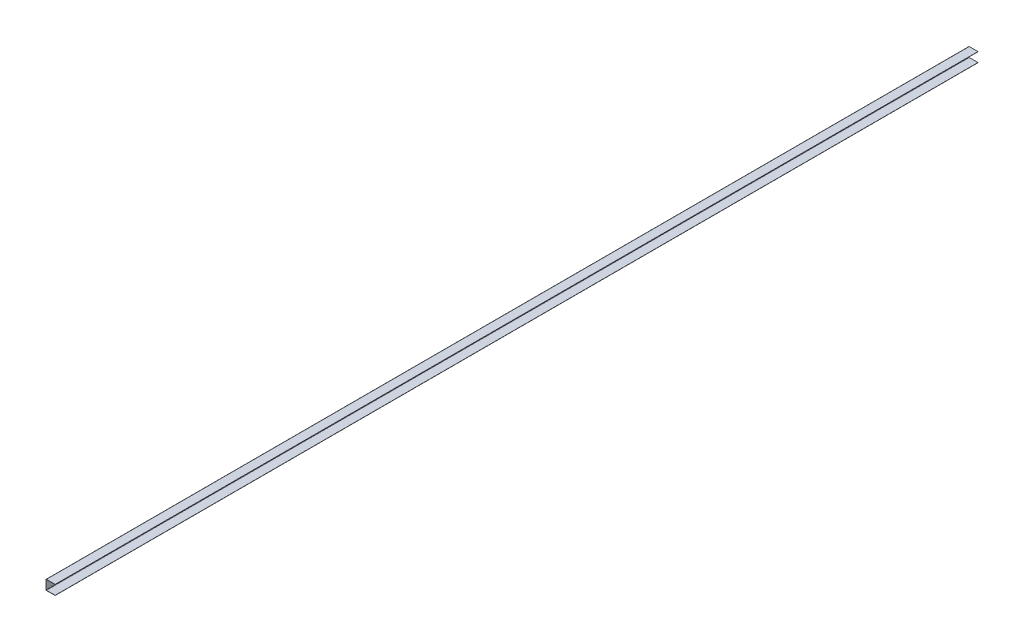
from build123d import *

# Parameters (mm, degrees)
SM_BASE_FLANGE_1_DEPTH = 2775


# Sheet-metal steps are written as plain solids
with BuildPart() as part:
    # Sketch 1 → Базовая кромка1 (new body)
    with BuildSketch(Plane.XY):
        with BuildLine():
            Line((27, 14), (0.75, 14))
            ThreePointArc((0.75, 14), (0.219669914, 13.780330086), (0, 13.25))
            Line((0, 13.25), (0, -13.25))
            ThreePointArc((0, -13.25), (0.219669914, -13.780330086), (0.75, -14))
            Line((0.75, -14), (27, -14))
            Line((27, -14), (27, -14.5))
            Line((27, -14.5), (0.75, -14.5))
            ThreePointArc((0.75, -14.5), (-0.133883476, -14.133883476), (-0.5, -13.25))
            Line((-0.5, -13.25), (-0.5, 13.25))
            ThreePointArc((-0.5, 13.25), (-0.133883476, 14.133883476), (0.75, 14.5))
            Line((0.75, 14.5), (27, 14.5))
            Line((27, 14.5), (27, 14))
        make_face()
    extrude(amount=-SM_BASE_FLANGE_1_DEPTH)


solid = part.part
